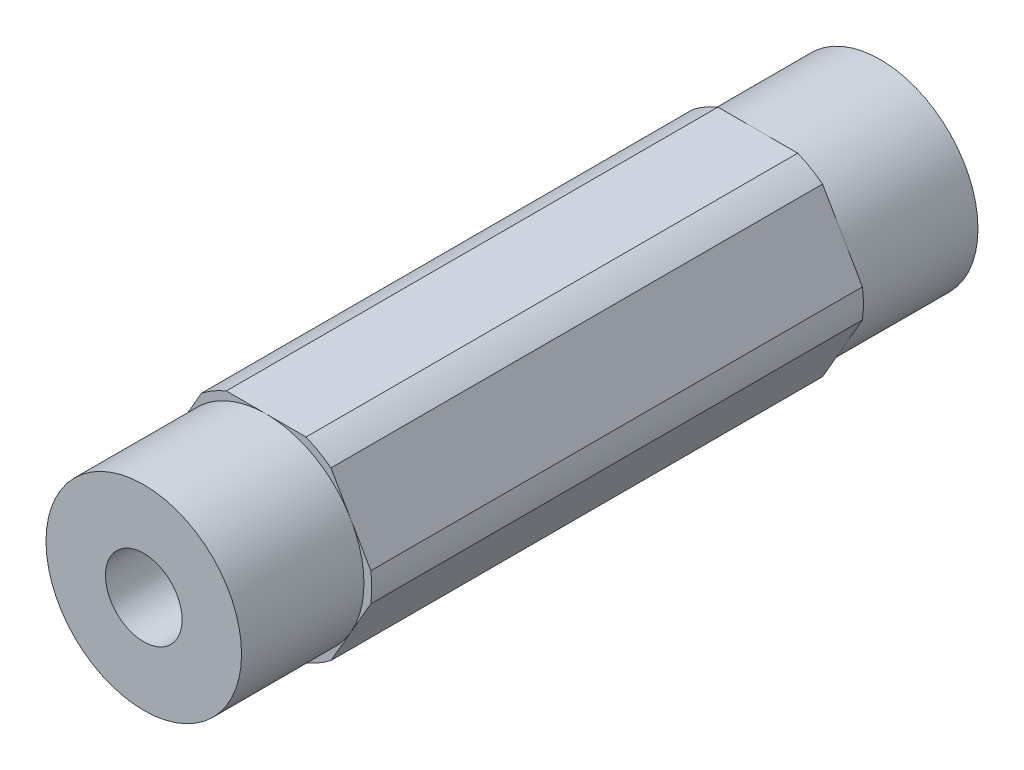
from build123d import *

# Parameters (mm, degrees)
BOSS_EXTRUDE1_DEPTH = 23.9141
SKETCH3_OUTSIDE_W   = 26.986
SKETCH3_OUTSIDE_H   = 25.022
SKETCH3_OUTSIDE_R   = 6.35
CUT_EXTRUDE2_DEPTH  = 7.9502
SKETCH4_OUTSIDE_W   = 26.986
SKETCH4_OUTSIDE_H   = 25.022
SKETCH4_OUTSIDE_R   = 6.858
CUT_EXTRUDE3_DEPTH  = 49.801870339
SKETCH5_R           = 2.4892
CUT_EXTRUDE4_DEPTH  = 49.732857286


with BuildPart() as part:
    # Sketch1 → Boss-Extrude1 (new, symmetric)
    with BuildSketch(Plane.XY):
        Polygon((7.332348419, 0), (3.666174209, 6.35), (-3.666174209, 6.35), (-7.332348419, 0), (-3.666174209, -6.35), (3.666174209, -6.35), align=None)
    extrude(amount=BOSS_EXTRUDE1_DEPTH, both=True)

    # Sketch3 outside → Cut-Extrude2 (cut)
    with BuildSketch(Plane.XY.offset(23.9141)):
        Rectangle(SKETCH3_OUTSIDE_W, SKETCH3_OUTSIDE_H)
        Circle(SKETCH3_OUTSIDE_R, mode=Mode.SUBTRACT)
    cut_extrude2 = extrude(amount=-CUT_EXTRUDE2_DEPTH, mode=Mode.SUBTRACT)

    # Sketch4 outside → Cut-Extrude3 (cut, through all)
    with BuildSketch(Plane.XY.offset(23.9141)):
        Rectangle(SKETCH4_OUTSIDE_W, SKETCH4_OUTSIDE_H)
        Circle(SKETCH4_OUTSIDE_R, mode=Mode.SUBTRACT)
    extrude(amount=-CUT_EXTRUDE3_DEPTH, mode=Mode.SUBTRACT)

    # Sketch5 → Cut-Extrude4 (cut, through all)
    with BuildSketch(Plane.XY.offset(23.9141)):
        Circle(SKETCH5_R)
    extrude(amount=-CUT_EXTRUDE4_DEPTH, mode=Mode.SUBTRACT)

    # Mirror1: Cut-Extrude2 across plane
    add(cut_extrude2.mirror(Plane.XY), mode=Mode.SUBTRACT)


solid = part.part
